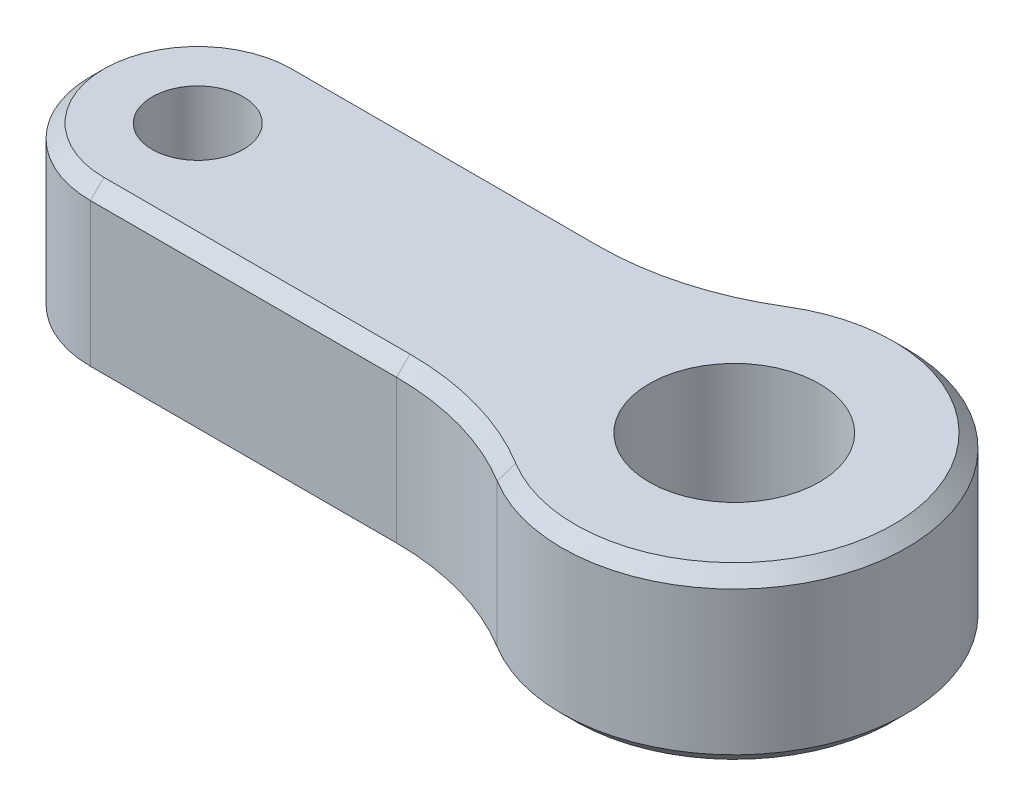
from build123d import *

# Parameters (mm, degrees)
SKETCH2_R           = 1.7
SKETCH2_R_2         = 3.175
BOSS_EXTRUDE1_DEPTH = 6.35
FILLET1_R           = 10
CHAMFER2_SIZE       = 0.5


with BuildPart() as part:
    # Sketch2 → Boss-Extrude1 (new body)
    with BuildSketch(Plane(origin=(0, 0, 0), x_dir=(1, 0, 0), z_dir=(0, 1, 0))):
        with BuildLine():
            Line((14.972015811, 4), (0, 4))
            ThreePointArc((0, 4), (-4, 0), (0, -4))
            Line((0, -4), (14.972015811, -4))
            ThreePointArc((14.972015811, -4), (26.425, 0), (14.972015811, 4))
        make_face()
        Circle(SKETCH2_R, mode=Mode.SUBTRACT)
        with Locations((20, 0)):
            Circle(SKETCH2_R_2, mode=Mode.SUBTRACT)
    extrude(amount=BOSS_EXTRUDE1_DEPTH)

    # Fillet1
    fillet1_edges = [part.edges().sort_by_distance(p)[0] for p in [
        (14.972015811, 3.175, 4),
        (14.972015811, 3.175, -4),
    ]]
    fillet(fillet1_edges, radius=FILLET1_R)

    # Chamfer2
    chamfer2_edges = [part.edges().sort_by_distance(p)[0] for p in [
        (14.127426014, 0, 4.376177452),
        (5.705217555, 0, 4),
        (26.425, 0, 0),
        (-4, 0, 0),
        (14.127426014, 0, -4.376177452),
        (5.705217555, 0, -4),
        (14.127426014, 6.35, 4.376177452),
        (5.705217555, 6.35, 4),
        (26.425, 6.35, 0),
        (-4, 6.35, 0),
        (14.127426014, 6.35, -4.376177452),
        (5.705217555, 6.35, -4),
    ]]
    chamfer(chamfer2_edges, length=CHAMFER2_SIZE)


solid = part.part
